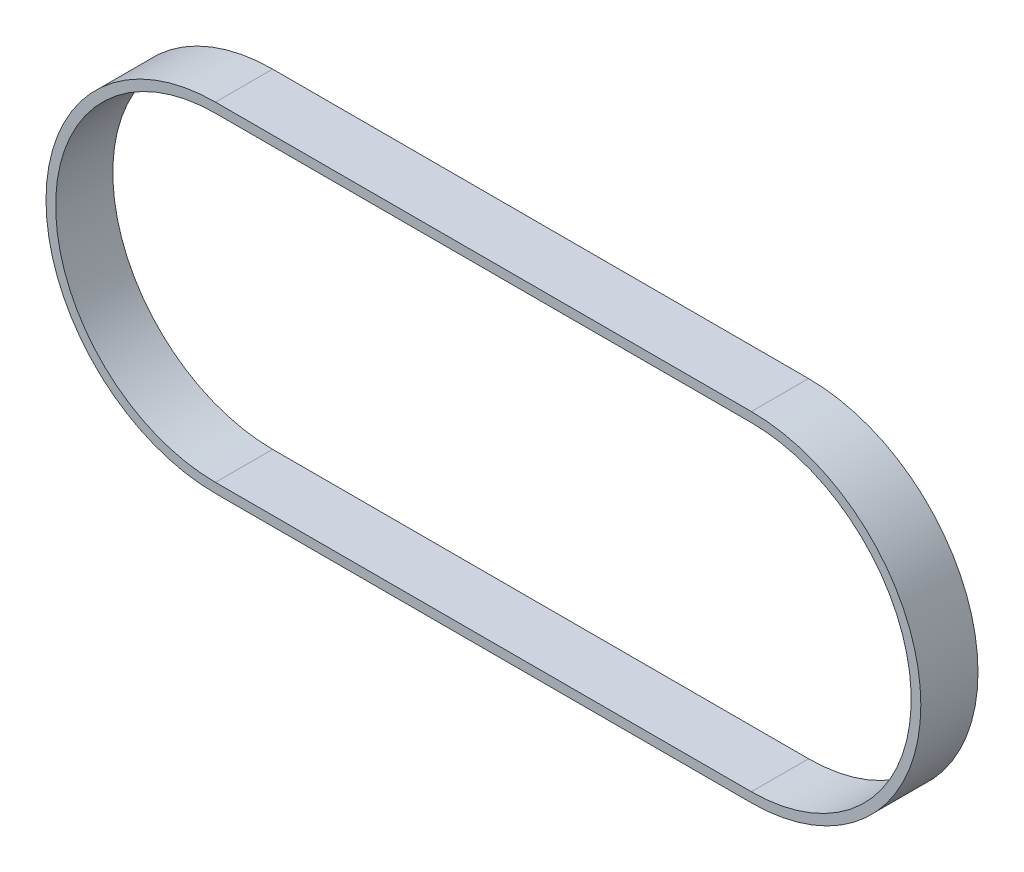
from build123d import *

# Parameters (mm, degrees)
EXTRUDE_1_DEPTH = 4.8
EXTRUDE_2_DEPTH = 4.8


# Read off the part's stored shape, not the designer's step: 交差1
with BuildPart() as part:
    # ｽｹｯﾁ1 → 押し出し-薄板1 (new body)
    with BuildSketch(Plane.XY):
        with BuildLine():
            Line((-22.5, 14.23), (22.5, 14.23))
            ThreePointArc((22.5, 14.23), (36.73, 0), (22.5, -14.23))
            Line((22.5, -14.23), (-22.5, -14.23))
            ThreePointArc((-22.5, -14.23), (-36.73, 0), (-22.5, 14.23))
        make_face()
        with BuildLine():
            Line((-22.5, 13.42), (22.5, 13.42))
            ThreePointArc((22.5, 13.42), (35.92, 0), (22.5, -13.42))
            Line((22.5, -13.42), (-22.5, -13.42))
            ThreePointArc((-22.5, -13.42), (-35.92, 0), (-22.5, 13.42))
        make_face(mode=Mode.SUBTRACT)
    extrude(amount=EXTRUDE_1_DEPTH)


with BuildPart() as body_2:
    # ｽｹｯﾁ2 → 押し出し-薄板2 (new body)
    with BuildSketch(Plane.XY.offset(4.8)):
        with BuildLine():
            Line((-22.5, -14.23), (22.5, -14.23))
            ThreePointArc((22.5, -14.23), (36.73, 0), (22.5, 14.23))
            Line((22.5, 14.23), (-22.5, 14.23))
            ThreePointArc((-22.5, 14.23), (-36.73, 0), (-22.5, -14.23))
        make_face()
        with BuildLine():
            Line((-22.5, -13.93), (22.5, -13.93))
            ThreePointArc((22.5, -13.93), (36.43, 0), (22.5, 13.93))
            Line((22.5, 13.93), (-22.5, 13.93))
            ThreePointArc((-22.5, 13.93), (-36.43, 0), (-22.5, -13.93))
        make_face(mode=Mode.SUBTRACT)
    extrude(amount=-EXTRUDE_2_DEPTH)


solid = part.part
